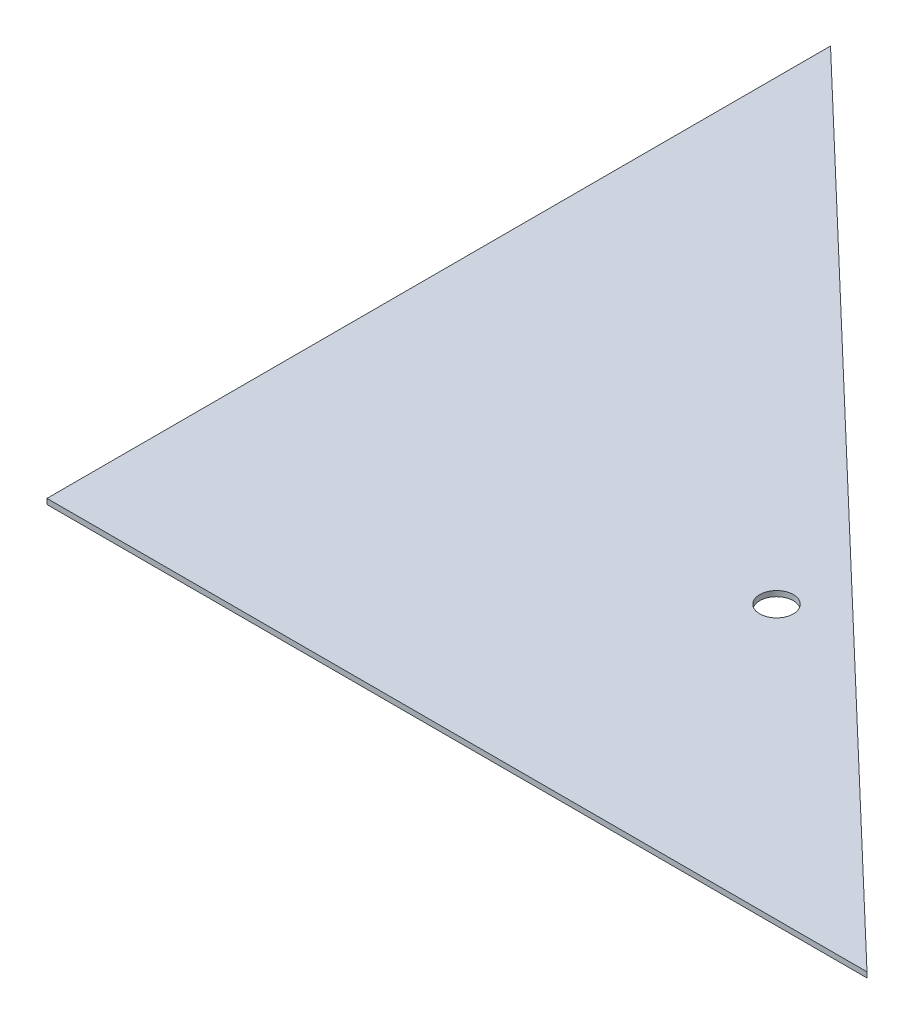
from build123d import *

# Parameters (mm, degrees)
BOSS_EXTRUDE1_DEPTH = 2.54
SKETCH2_R           = 7.9375
CUT_EXTRUDE1_DEPTH  = 2.54


with BuildPart() as part:
    # Sketch1 → Boss-Extrude1 (new body)
    with BuildSketch(Plane(origin=(0, 0, 0), x_dir=(1, 0, 0), z_dir=(0, 1, 0))):
        Polygon((-218.531932836, 50.035921397), (-218.531932836, -320.561742537), (169.326067164, -320.561742537), align=None)
    extrude(amount=BOSS_EXTRUDE1_DEPTH)

    # Sketch2 → Cut-Extrude1 (cut)
    with BuildSketch(Plane(origin=(0, 2.54, 0), x_dir=(1, 0, 0), z_dir=(0, 1, 0))):
        with Locations((-2.631932836, -191.387008755)):
            Circle(SKETCH2_R)
    extrude(amount=-CUT_EXTRUDE1_DEPTH, mode=Mode.SUBTRACT)


solid = part.part
